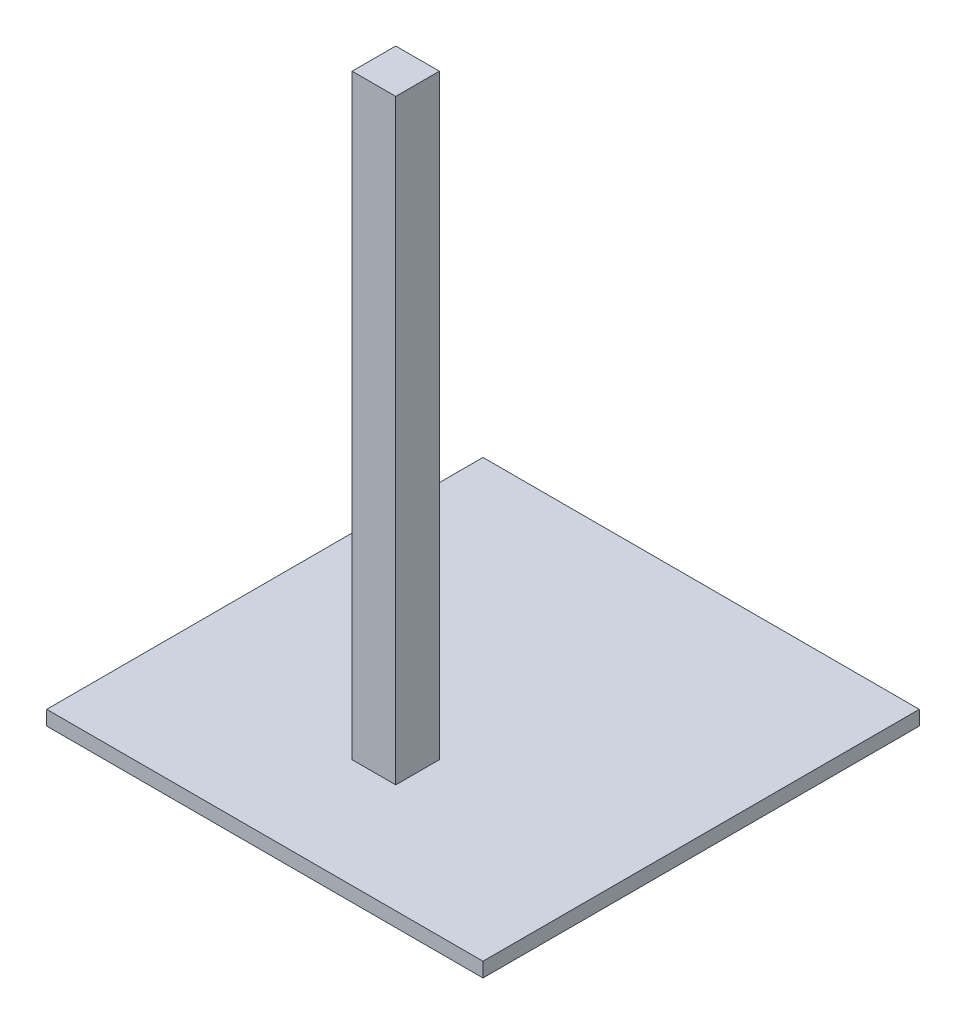
from build123d import *

# Parameters (mm, degrees)
SKETCH1_W           = 76.2
SKETCH1_H           = 76.2
BOSS_EXTRUDE1_DEPTH = 2.54
SKETCH2_W           = 7.62
SKETCH2_H           = 7.62
BOSS_EXTRUDE2_DEPTH = 104.14


with BuildPart() as part:
    # Sketch1 → Boss-Extrude1 (new body)
    with BuildSketch(Plane(origin=(0, 0, 0), x_dir=(1, 0, 0), z_dir=(0, 1, 0))):
        Rectangle(SKETCH1_W, SKETCH1_H)
    extrude(amount=BOSS_EXTRUDE1_DEPTH)

    # Sketch2 → Boss-Extrude2 (add)
    with BuildSketch(Plane(origin=(0, 2.54, 0), x_dir=(1, 0, 0), z_dir=(0, 1, 0))):
        with Locations((0, -15.24)):
            Rectangle(SKETCH2_W, SKETCH2_H)
    extrude(amount=BOSS_EXTRUDE2_DEPTH)


solid = part.part
